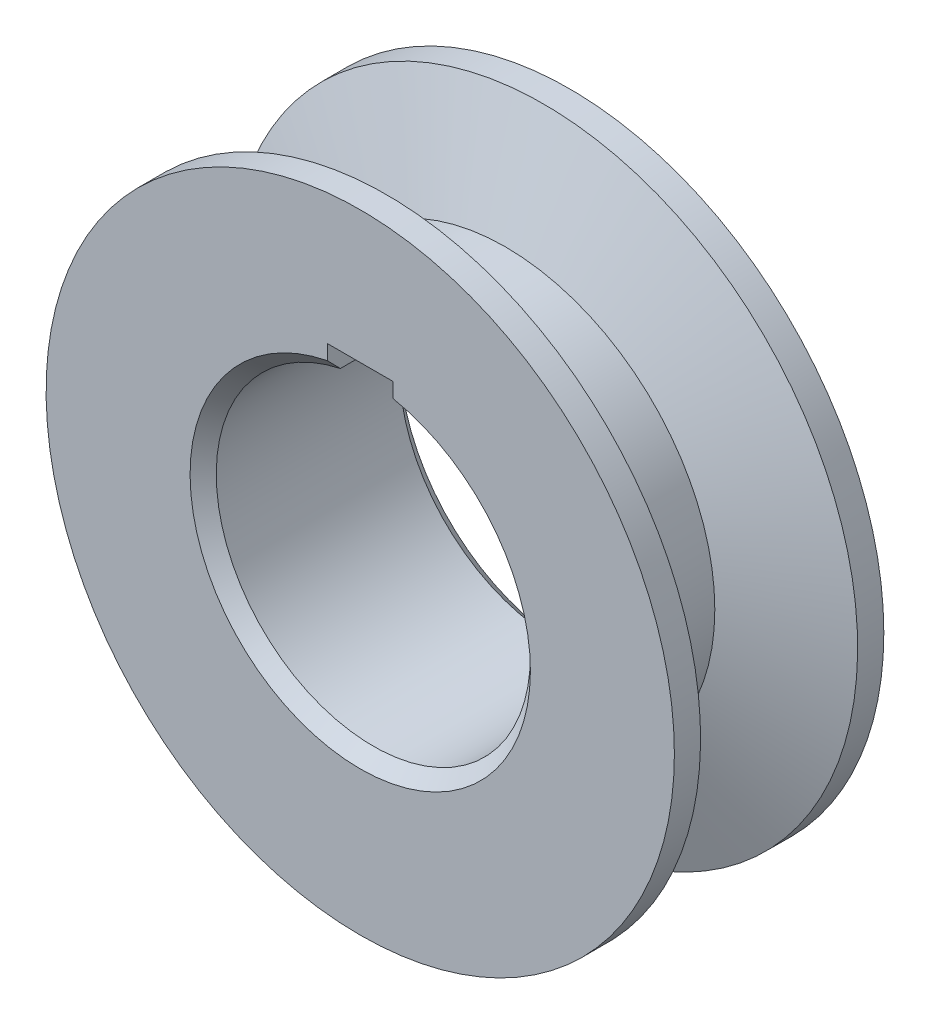
from build123d import *

# Parameters (mm, degrees)
SKETCH1_R          = 19.05
SKETCH1_R_2        = 9.525
EXTRUDE1_DEPTH     = 6.35
CHAMFER1_SIZE      = 0.79375
SKETCH3_W          = 4
SKETCH3_H          = 3
CUT_EXTRUDE1_DEPTH = 30.784140075


with BuildPart() as part:
    # Sketch1 → Extrude1 (new, symmetric)
    with BuildSketch(Plane.XY):
        Circle(SKETCH1_R)
        Circle(SKETCH1_R_2, mode=Mode.SUBTRACT)
    extrude(amount=EXTRUDE1_DEPTH, both=True)

    # Chamfer1
    chamfer1_edges = [part.edges().sort_by_distance(p)[0] for p in [
        (-9.525, 0, -6.35),
        (-9.525, 0, 6.35),
    ]]
    chamfer(chamfer1_edges, length=CHAMFER1_SIZE)

    # Sketch2 → Cut-Revolve1 (revolve, cut)
    with BuildSketch(Plane(origin=(0, 0, 0), x_dir=(0, 0, -1), z_dir=(1, 0, 0))):
        Polygon((-4.7625, 19.05), (4.7625, 19.05), (2.451289012, 12.7), (-2.451289012, 12.7), align=None)
    revolve(axis=Axis((0, 0, 6.35), (0, 0, -1)), mode=Mode.SUBTRACT)

    # Sketch3 → Cut-Extrude1 (cut, through all)
    with BuildSketch(Plane(origin=(0, 0, -6.35), x_dir=(-1, 0, 0), z_dir=(0, 0, -1))):
        with Locations((0, 9.525)):
            Rectangle(SKETCH3_W, SKETCH3_H)
    extrude(amount=-CUT_EXTRUDE1_DEPTH, mode=Mode.SUBTRACT)


solid = part.part
